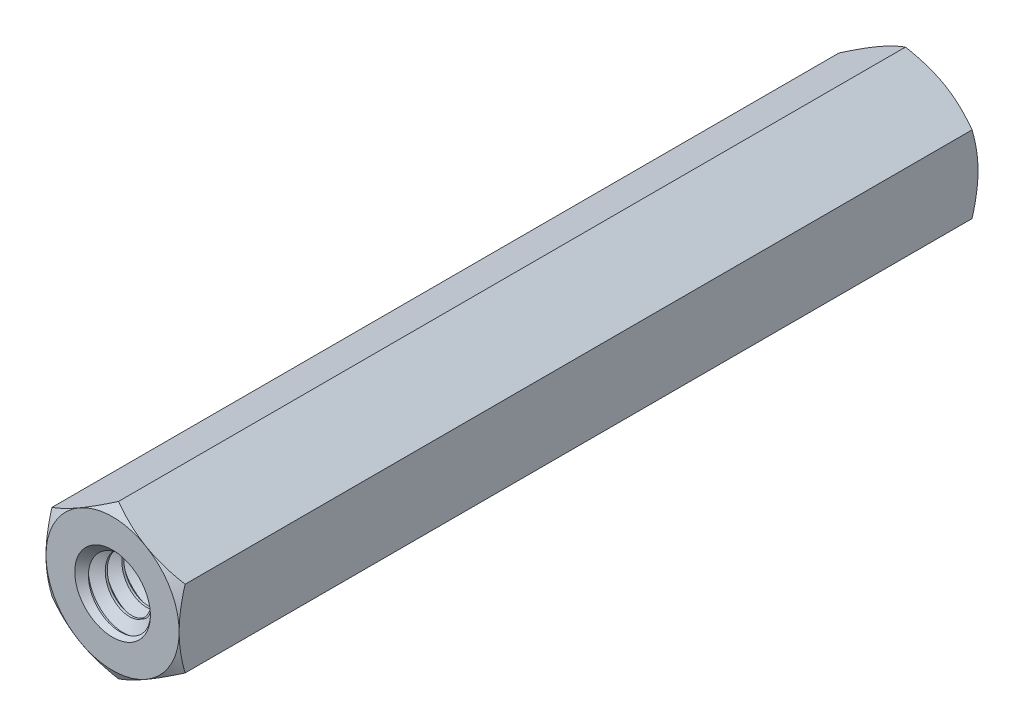
from build123d import *

# Parameters (mm, degrees)
EXTRUDE1_DEPTH          = 19.05
EXTRUDE1_DEPTH_BACK     = 19.05
SKETCH1_R               = 1.7526
SWEEP1_PITCH            = 0.79375
EXTRUDE2_DEPTH          = 40.195136557
SKETCH8_OUTSIDE_W       = 155.608
SKETCH8_OUTSIDE_H       = 156.59
SKETCH8_OUTSIDE_R       = 3.175
EXTRUDE4_DEPTH          = 40.195136557
EXTRUDE4_DRAFT          = -60
MIRROR1_COPY_1_SKETCH_W = 155.608
MIRROR1_COPY_1_SKETCH_H = 156.59
MIRROR1_COPY_1_SKETCH_R = 3.175
MIRROR1_COPY_1_DEPTH    = 40.195136557
MIRROR1_COPY_1_DRAFT    = -60
SKETCH9_W               = 19.05
SKETCH9_H               = 1.8034


with BuildPart() as part:
    # Sketch1 → Extrude1 (new, two sides: drawn at the far end of the back side and taken through both)
    with BuildSketch(Plane.XY.offset(-EXTRUDE1_DEPTH_BACK)):
        Polygon((0, 3.666174209), (-3.175, 1.833087105), (-3.175, -1.833087105), (0, -3.666174209), (3.175, -1.833087105), (3.175, 1.833087105), align=None)
        with Locations(Location((0, 0, 0), (0, 0, 180))):
            Circle(SKETCH1_R, mode=Mode.SUBTRACT)
    extrude(amount=EXTRUDE1_DEPTH + EXTRUDE1_DEPTH_BACK)

    # Sweep1: arcs per turn and ends read off the stored shape
    # Sweep1: the profile of Sketch12 profile screwed along a right-hand helix through 49 turns, 8 arcs to a turn; built about Z, then put on its axis
    sweep1_z = Axis((0, 0, 0), (0, 0, 1))
    sweep1_corners = [(1.7529, 0, -0.694704455), (1.7529, 0, 0.000173205), (1.237044252, 0, -0.29765625), (1.237044252, 0, -0.396875)]
    with BuildLine(mode=Mode.PRIVATE) as sweep1_profile:
        Line(sweep1_corners[0], sweep1_corners[1])
        Line(sweep1_corners[1], sweep1_corners[2])
        Line(sweep1_corners[2], sweep1_corners[3])
        Line(sweep1_corners[3], sweep1_corners[0])
    sweep1_cap = Face(sweep1_profile.wire())
    sweep1_turn_angles = [0, 22.5, 45, 67.5, 90, 112.5, 135, 157.5, 180, 202.5, 225, 247.5, 270, 292.5, 315, 337.5, 360]
    sweep1_turn_weights = [1, 0.9238795325112867, 1, 0.9238795325112867, 1, 0.9238795325112867, 1, 0.9238795325112867, 1, 0.9238795325112867, 1, 0.9238795325112867, 1, 0.9238795325112867, 1, 0.9238795325112867, 1]
    sweep1_turn_rails = [Edge.make_bspline([Vector(p[0], p[1], 0).rotate(sweep1_z, sweep1_turn_angles[k]) / sweep1_turn_weights[k] + Vector(0, 0, p[2] + SWEEP1_PITCH * sweep1_turn_angles[k] / 360) for k in range(17)], [0, 0, 0, 1, 1, 2, 2, 3, 3, 4, 4, 5, 5, 6, 6, 7, 7, 8, 8, 8], 2, sweep1_turn_weights) for p in sweep1_corners]
    sweep1_turn_sides = [Face.make_surface_from_curves(sweep1_turn_rails[p[0]], sweep1_turn_rails[p[1]]) for p in [(0, 1), (1, 2), (2, 3), (3, 0)]]
    sweep1 = Plane(origin=(0, 0, -19.05), x_dir=(0, 1, 0), z_dir=(0, 0, 1)) * Solid(Shell([*[p.moved(Location((0, 0, SWEEP1_PITCH * i))) for i in range(49) for p in sweep1_turn_sides], sweep1_cap, sweep1_cap.rotate(sweep1_z, 17640).moved(Location((0, 0, SWEEP1_PITCH * 17640 / 360)))]))
    add(sweep1)

    # Sketch6 → Extrude2 (cut, through all)
    with BuildSketch(Plane(origin=(0, 0, -19.05), x_dir=(-1, 0, 0), z_dir=(0, 0, -1))):
        Polygon((0, 3.666174209), (-3.175, 1.833087105), (-3.175, -1.833087105), (0, -3.666174209), (3.175, -1.833087105), (3.175, 1.833087105), align=None)
    extrude2 = extrude(amount=EXTRUDE2_DEPTH, mode=Mode.SUBTRACT)

    # Extrude3 cone 1 section (through the dimple's axis) → Extrude3 (revolve, cut)
    with BuildSketch(Plane(origin=(0, 0, -19.05), x_dir=(0, 1, 0), z_dir=(1, 0, 0))):
        Polygon((0, 0), (1.8034, 0), (0, 1.933909732), align=None)
    extrude3 = revolve(axis=Axis((0, 0, -19.05), (0, 0, 1)), mode=Mode.SUBTRACT)


with BuildPart() as extrude4_tool:
    # Sketch8 outside → Extrude4 (with draft: the straight prism first)
    with BuildSketch(Plane(origin=(0, 0, -19.05), x_dir=(-1, 0, 0), z_dir=(0, 0, -1))):
        Rectangle(SKETCH8_OUTSIDE_W, SKETCH8_OUTSIDE_H)
        Circle(SKETCH8_OUTSIDE_R, mode=Mode.SUBTRACT)
    extrude(amount=-EXTRUDE4_DEPTH)
    # Extrude4: the draft: its side faces are tilted about the plane it starts from
    extrude4_sides = [extrude4_tool.faces().sort_by_distance(p)[0] for p in [
        (0, -78.295, 1.047568279),
        (-77.804, 0, 1.047568279),
        (0, 78.295, 1.047568279),
        (77.804, 0, 1.047568279),
        (3.175, 0, 1.047568279),
    ]]
    draft(extrude4_sides, Plane(origin=(0, 0, -19.05), x_dir=(-1, 0, 0), z_dir=(0, 0, -1)), EXTRUDE4_DRAFT)


with BuildPart() as part_1:
    add(part.part)

    # Extrude4: cut by extrude4_tool
    add(extrude4_tool.part, mode=Mode.SUBTRACT)

    # Mirror1: Extrude2, Extrude3 across plane
    add(extrude2.mirror(Plane.XY), mode=Mode.SUBTRACT)
    add(extrude3.mirror(Plane.XY), mode=Mode.SUBTRACT)


with BuildPart() as mirror1_copy_1_tool:
    # Mirror1 copy 1 sketch → Mirror1 copy 1 (with draft: the straight prism first)
    with BuildSketch(Plane(origin=(0, 0, 19.05), x_dir=(-1, 0, 0), z_dir=(0, 0, 1))):
        Rectangle(MIRROR1_COPY_1_SKETCH_W, MIRROR1_COPY_1_SKETCH_H)
        Circle(MIRROR1_COPY_1_SKETCH_R, mode=Mode.SUBTRACT)
    extrude(amount=-MIRROR1_COPY_1_DEPTH)
    # Mirror1 copy 1: the draft: its side faces are tilted about the plane it starts from
    mirror1_copy_1_sides = [mirror1_copy_1_tool.faces().sort_by_distance(p)[0] for p in [
        (0, -78.295, -1.047568279),
        (-77.804, 0, -1.047568279),
        (0, 78.295, -1.047568279),
        (77.804, 0, -1.047568279),
        (3.175, 0, -1.047568279),
    ]]
    draft(mirror1_copy_1_sides, Plane(origin=(0, 0, 19.05), x_dir=(-1, 0, 0), z_dir=(0, 0, 1)), MIRROR1_COPY_1_DRAFT)


with BuildPart() as part_2:
    add(part_1.part)

    # Mirror1 copy 1: cut by mirror1_copy_1_tool
    add(mirror1_copy_1_tool.part, mode=Mode.SUBTRACT)

    # Sketch9 → Revolve 2 (revolve)
    with BuildSketch(Plane(origin=(0, 0, 0), x_dir=(0, 0, -1), z_dir=(1, 0, 0)), mode=Mode.PRIVATE) as revolve_2_sk:
        with Locations((0, 0.9017)):
            Rectangle(SKETCH9_W, SKETCH9_H)
    revolve(revolve_2_sk.sketch.rotate(Axis((0, 0, 19.05), (0, 0, -1)), 270), axis=Axis((0, 0, 19.05), (0, 0, -1)))


solid = part_2.part
